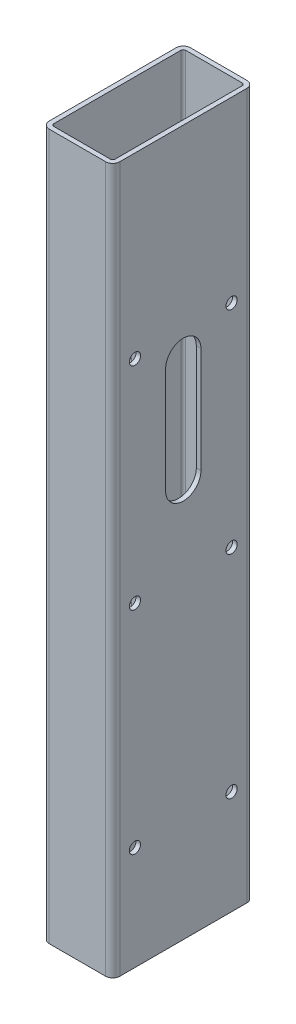
from build123d import *

# Parameters (mm, degrees)
EXTRUDE_THIN1_DEPTH = 254
CUT_EXTRUDE1_REACH  = 258.527
CUT_EXTRUDE4_REACH  = 258.527
SKETCH4_R           = 2.0193
CUT_EXTRUDE3_DEPTH  = 257.527425434


with BuildPart() as part:
    # Sketch1 → Extrude-Thin1 (new body)
    with BuildSketch(Plane(origin=(0, 0, 0), x_dir=(1, 0, 0), z_dir=(0, 1, 0))):
        with BuildLine():
            Line((-10.16, 25.4), (10.16, 25.4))
            ThreePointArc((10.16, 25.4), (11.956051224, 24.656051224), (12.7, 22.86))
            Line((12.7, 22.86), (12.7, -22.86))
            ThreePointArc((12.7, -22.86), (11.956051224, -24.656051224), (10.16, -25.4))
            Line((10.16, -25.4), (-10.16, -25.4))
            ThreePointArc((-10.16, -25.4), (-11.956051224, -24.656051224), (-12.7, -22.86))
            Line((-12.7, -22.86), (-12.7, 22.86))
            ThreePointArc((-12.7, 22.86), (-11.956051224, 24.656051224), (-10.16, 25.4))
        make_face()
        with BuildLine():
            Line((-10.16, 23.749), (10.16, 23.749))
            ThreePointArc((10.16, 23.749), (10.788617928, 23.488617928), (11.049, 22.86))
            Line((11.049, 22.86), (11.049, -22.86))
            ThreePointArc((11.049, -22.86), (10.788617928, -23.488617928), (10.16, -23.749))
            Line((10.16, -23.749), (-10.16, -23.749))
            ThreePointArc((-10.16, -23.749), (-10.788617928, -23.488617928), (-11.049, -22.86))
            Line((-11.049, -22.86), (-11.049, 22.86))
            ThreePointArc((-11.049, 22.86), (-10.788617928, 23.488617928), (-10.16, 23.749))
        make_face(mode=Mode.SUBTRACT)
    extrude(amount=-EXTRUDE_THIN1_DEPTH)

    # Sketch2 → Cut-Extrude1 (cut, up to next)
    with BuildSketch(Plane.ZY.offset(12.7), mode=Mode.PRIVATE) as cut_extrude1_sk1:
        with BuildLine():
            Line((6.6675, -72.795460317), (6.6675, -207.945957212))
            ThreePointArc((6.6675, -207.945957212), (0, -214.613457212), (-6.6675, -207.945957212))
            Line((-6.6675, -207.945957212), (-6.6675, -72.795460317))
            ThreePointArc((-6.6675, -72.795460317), (0, -66.127960317), (6.6675, -72.795460317))
        make_face()
    cut_extrude1_tool1 = extrude(cut_extrude1_sk1.sketch, amount=-CUT_EXTRUDE1_REACH, mode=Mode.PRIVATE) & part.part
    add(cut_extrude1_tool1.solids().sort_by_distance((-12.7, -140.370709, 0))[0], mode=Mode.SUBTRACT)

    # Sketch5 → Cut-Extrude4 (cut, up to next)
    with BuildSketch(Plane(origin=(12.7, 0, 0), x_dir=(0, 0, -1), z_dir=(1, 0, 0)), mode=Mode.PRIVATE) as cut_extrude4_sk1:
        with BuildLine():
            Line((6.35, -72.795460317), (6.35, -110.895460317))
            ThreePointArc((6.35, -110.895460317), (0, -117.245460317), (-6.35, -110.895460317))
            Line((-6.35, -110.895460317), (-6.35, -72.795460317))
            ThreePointArc((-6.35, -72.795460317), (0, -66.445460317), (6.35, -72.795460317))
        make_face()
    cut_extrude4_tool1 = extrude(cut_extrude4_sk1.sketch, amount=-CUT_EXTRUDE4_REACH, mode=Mode.PRIVATE) & part.part
    add(cut_extrude4_tool1.solids().sort_by_distance((12.7, -91.84546, 0))[0], mode=Mode.SUBTRACT)

    # Sketch4 → Cut-Extrude3 (cut, through all)
    with BuildSketch(Plane(origin=(12.7, 0, 0), x_dir=(0, 0, -1), z_dir=(1, 0, 0))):
        with Locations((-17.399, -216.570712517)):
            Circle(SKETCH4_R)
        with Locations((17.399, -216.570712517)):
            Circle(SKETCH4_R)
        with Locations((-17.399, -140.370712517)):
            Circle(SKETCH4_R)
        with Locations((17.399, -140.370712517)):
            Circle(SKETCH4_R)
        with Locations((-17.399, -64.170712517)):
            Circle(SKETCH4_R)
        with Locations((17.399, -64.170712517)):
            Circle(SKETCH4_R)
    extrude(amount=-CUT_EXTRUDE3_DEPTH, mode=Mode.SUBTRACT)


solid = part.part
